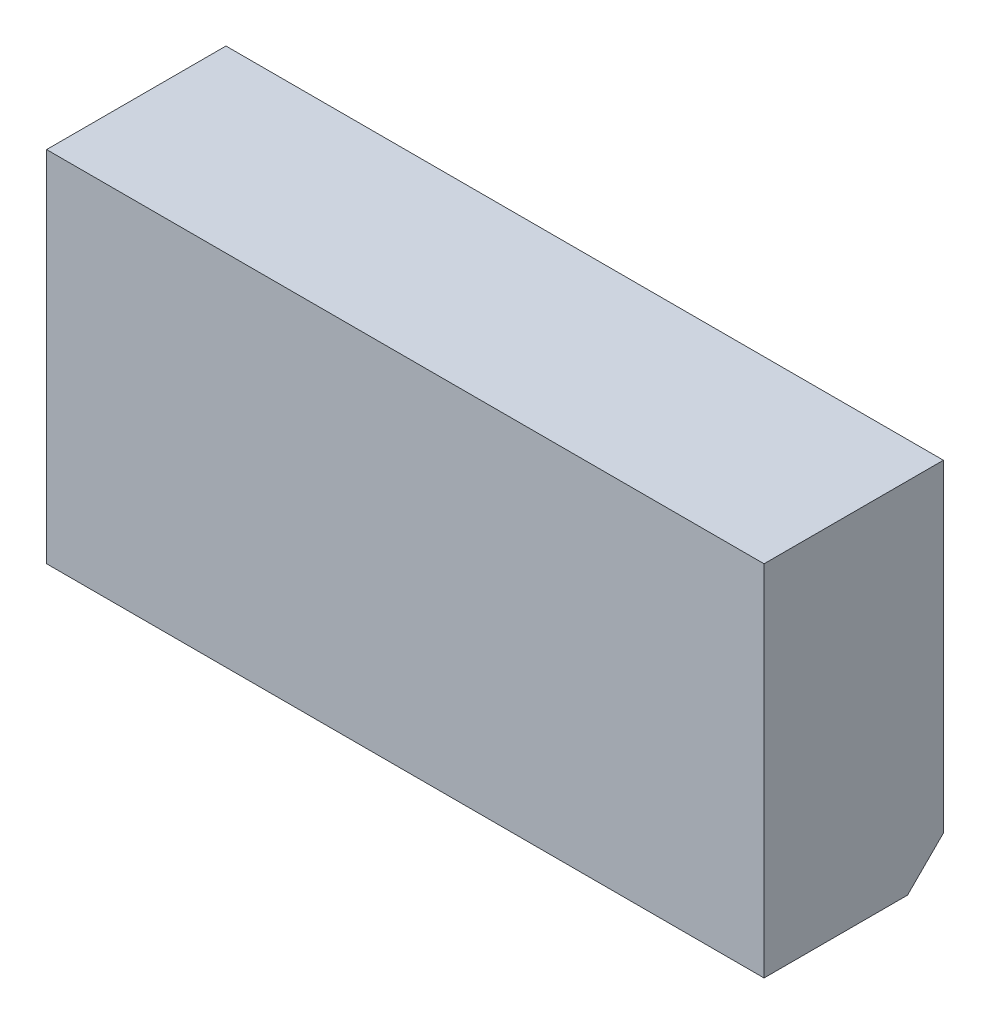
from build123d import *

# Parameters (mm, degrees)
SKETCH1_W           = 40
SKETCH1_H           = 20
BOSS_EXTRUDE1_DEPTH = 10
CHAMFER1_SIZE       = 2


with BuildPart() as part:
    # Sketch1 → Boss-Extrude1 (new body)
    with BuildSketch(Plane.XY):
        with Locations((20, 10)):
            Rectangle(SKETCH1_W, SKETCH1_H)
    extrude(amount=BOSS_EXTRUDE1_DEPTH)

    # Chamfer1
    chamfer1_edges = [part.edges().sort_by_distance(p)[0] for p in [
        (20, 0, 0),
    ]]
    chamfer(chamfer1_edges, length=CHAMFER1_SIZE)


solid = part.part
